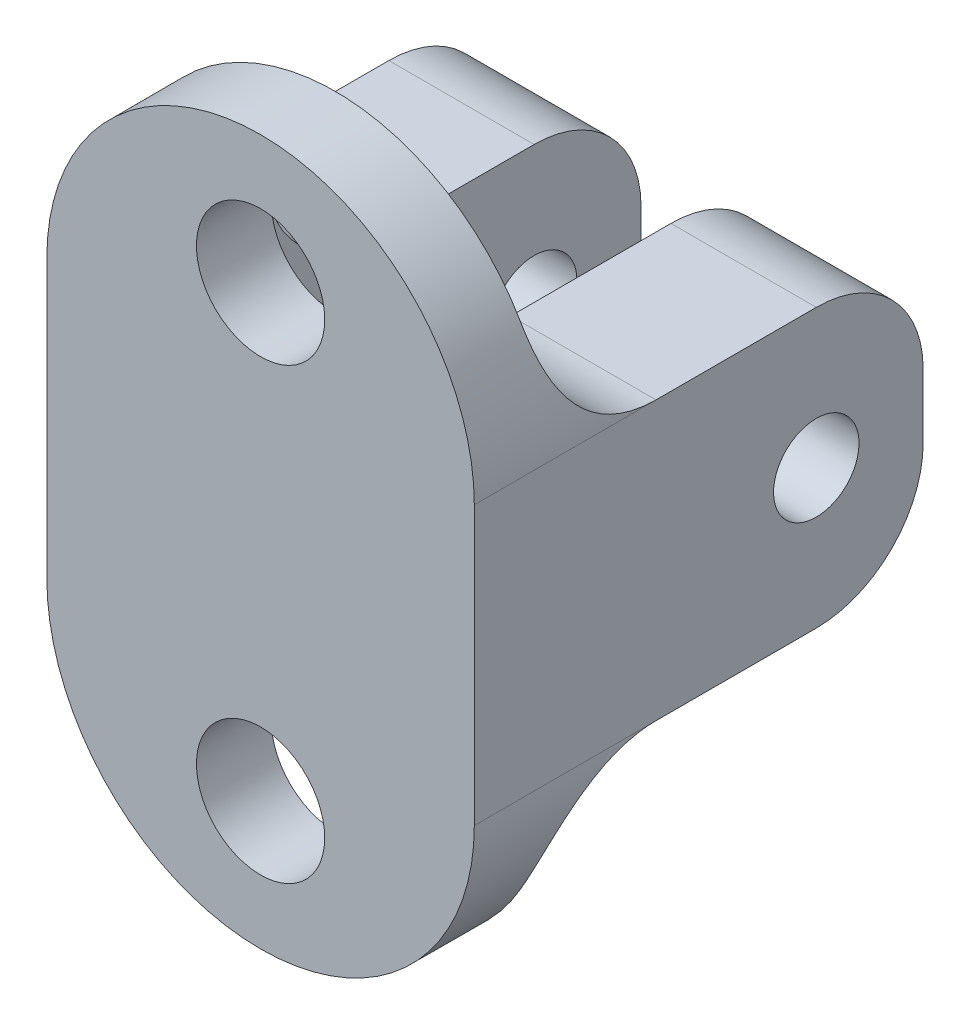
from build123d import *

# Parameters (mm, degrees)
ESQUISSE1_R             = 3
BOSS_EXTRU_1_DEPTH      = 5
ESQUISSE2_R             = 2
BOSS_EXTRU_2_DEPTH      = 20
ESQUISSE3_W             = 6.4
ESQUISSE3_H             = 20
ENL_V_MAT_EXTRU_1_DEPTH = 20
CONG_1_R                = 5
ESQUISSE4_W             = 33.851998375
ESQUISSE4_H             = 43.433745971
ENL_V_MAT_EXTRU_2_DEPTH = 1.5


with BuildPart() as part:
    # Esquisse1 → Boss.-Extru.1 (new body)
    with BuildSketch(Plane.XY):
        with BuildLine():
            Line((-8.244531767, 16.763285024), (-8.244531767, 3.763285024))
            ThreePointArc((-8.244531767, 3.763285024), (1.755468233, -6.236714976), (11.755468233, 3.763285024))
            Line((11.755468233, 3.763285024), (11.755468233, 16.763285024))
            ThreePointArc((11.755468233, 16.763285024), (1.755468233, 26.763285024), (-8.244531767, 16.763285024))
        make_face()
        with Locations((1.755468233, 20.763285024)):
            Circle(ESQUISSE1_R, mode=Mode.SUBTRACT)
        with Locations((1.755468233, -0.236714976)):
            Circle(ESQUISSE1_R, mode=Mode.SUBTRACT)
    extrude(amount=BOSS_EXTRU_1_DEPTH)

    # Esquisse2 → Boss.-Extru.2 (add)
    with BuildSketch(Plane(origin=(11.755468233, 0, 0), x_dir=(0, 0, -1), z_dir=(1, 0, 0))):
        with BuildLine():
            Line((0, 16.763285024), (12.5, 16.763285024))
            ThreePointArc((12.5, 16.763285024), (16.035533906, 15.29881893), (17.5, 11.763285024))
            Line((17.5, 11.763285024), (17.5, 8.763285024))
            ThreePointArc((17.5, 8.763285024), (16.035533906, 5.227751118), (12.5, 3.763285024))
            Line((12.5, 3.763285024), (0, 3.763285024))
            Line((0, 3.763285024), (0, 16.763285024))
        make_face()
        with Locations(Location((12.5, 10.263285024, 0), (0, 0, 90))):
            Circle(ESQUISSE2_R, mode=Mode.SUBTRACT)
    extrude(amount=-BOSS_EXTRU_2_DEPTH)

    # Esquisse3 → Enlèv. mat.-Extru.1 (cut)
    with BuildSketch(Plane(origin=(0, 3.763285024, 0), x_dir=(-1, 0, 0), z_dir=(0, -1, 0))):
        with Locations((-1.755468233, 10)):
            Rectangle(ESQUISSE3_W, ESQUISSE3_H)
    extrude(amount=-ENL_V_MAT_EXTRU_1_DEPTH, mode=Mode.SUBTRACT)

    # Congé1
    # the kernel refuses this fillet: 5 mm, written as the material it adds along each edge
    with BuildSketch(Plane(origin=(11.055468233, 3.763285024, 0), x_dir=(0, -1, 0), z_dir=(-1, 0, 0))) as cong_1_piece_1_section:
        with BuildLine():
            CenterArc((CONG_1_R, -CONG_1_R), CONG_1_R, 90, 90)
            Line((0, -CONG_1_R), (0, 0))
            Line((0, 0), (CONG_1_R, 0))
        make_face()
    cong_1_piece_1 = extrude(amount=31.8, mode=Mode.PRIVATE)
    cong_1_piece_1 = split(cong_1_piece_1, bisect_by=Plane(origin=(4.955468233, 2.647494644, -1.117206211), z_dir=(1, 0, 0)), keep=Keep.TOP, mode=Mode.PRIVATE)
    cong_1_piece_1 = cong_1_piece_1 & Plane(origin=(1.755468233, 3.763285024, -1.117206211), x_dir=(-1, 0, 0), z_dir=(0, 0, -1)) * Cylinder(10, 84, mode=Mode.PRIVATE)
    add(cong_1_piece_1)
    with BuildSketch(Plane(origin=(-1.444531767, 3.763285024, 0), x_dir=(0, -1, 0), z_dir=(-1, 0, 0))) as cong_1_piece_2_section:
        with BuildLine():
            CenterArc((CONG_1_R, -CONG_1_R), CONG_1_R, 90, 90)
            Line((0, -CONG_1_R), (0, 0))
            Line((0, 0), (CONG_1_R, 0))
        make_face()
    cong_1_piece_2 = extrude(amount=19.3, mode=Mode.PRIVATE)
    cong_1_piece_2 = cong_1_piece_2 & Plane(origin=(1.755468233, 3.763285024, -1.127936598), x_dir=(-1, 0, 0), z_dir=(0, 0, -1)) * Cylinder(10, 59, mode=Mode.PRIVATE)
    add(cong_1_piece_2)
    with BuildSketch(Plane(origin=(11.055468233, 16.763285024, 0), x_dir=(0, 1, 0), z_dir=(-1, 0, 0))) as cong_1_piece_3_section:
        with BuildLine():
            CenterArc((CONG_1_R, CONG_1_R), CONG_1_R, 180, 90)
            Line((0, CONG_1_R), (0, 0))
            Line((0, 0), (CONG_1_R, 0))
        make_face()
    cong_1_piece_3 = extrude(amount=31.8, mode=Mode.PRIVATE)
    cong_1_piece_3 = split(cong_1_piece_3, bisect_by=Plane(origin=(4.955468233, 17.879075405, -1.117206211), z_dir=(1, 0, 0)), keep=Keep.TOP, mode=Mode.PRIVATE)
    cong_1_piece_3 = cong_1_piece_3 & Plane(origin=(1.755468233, 16.763285024, -1.117206211), x_dir=(1, 0, 0), z_dir=(0, 0, -1)) * Cylinder(10, 84, mode=Mode.PRIVATE)
    add(cong_1_piece_3)
    with BuildSketch(Plane(origin=(-1.444531767, 16.763285024, 0), x_dir=(0, 1, 0), z_dir=(-1, 0, 0))) as cong_1_piece_4_section:
        with BuildLine():
            CenterArc((CONG_1_R, CONG_1_R), CONG_1_R, 180, 90)
            Line((0, CONG_1_R), (0, 0))
            Line((0, 0), (CONG_1_R, 0))
        make_face()
    cong_1_piece_4 = extrude(amount=19.3, mode=Mode.PRIVATE)
    cong_1_piece_4 = cong_1_piece_4 & Plane(origin=(1.755468233, 16.763285024, -1.127936804), x_dir=(1, 0, 0), z_dir=(0, 0, -1)) * Cylinder(10, 59, mode=Mode.PRIVATE)
    add(cong_1_piece_4)
    with BuildSketch(Plane(origin=(24.255468233, 3.763285024, 0), x_dir=(0, -1, 0), z_dir=(-1, 0, 0))) as cong_1_piece_5_section:
        with BuildLine():
            CenterArc((CONG_1_R, -CONG_1_R), CONG_1_R, 90, 90)
            Line((0, -CONG_1_R), (0, 0))
            Line((0, 0), (CONG_1_R, 0))
        make_face()
    cong_1_piece_5 = extrude(amount=19.3, mode=Mode.PRIVATE)
    cong_1_piece_5 = cong_1_piece_5 & Plane(origin=(1.755468233, 3.763285024, -1.127936804), x_dir=(-1, 0, 0), z_dir=(0, 0, -1)) * Cylinder(10, 59, mode=Mode.PRIVATE)
    add(cong_1_piece_5)
    with BuildSketch(Plane(origin=(24.255468233, 3.763285024, 0), x_dir=(0, -1, 0), z_dir=(-1, 0, 0))) as cong_1_piece_6_section:
        with BuildLine():
            CenterArc((CONG_1_R, -CONG_1_R), CONG_1_R, 90, 90)
            Line((0, -CONG_1_R), (0, 0))
            Line((0, 0), (CONG_1_R, 0))
        make_face()
    cong_1_piece_6 = extrude(amount=31.8, mode=Mode.PRIVATE)
    cong_1_piece_6 = split(cong_1_piece_6, bisect_by=Plane(origin=(-1.444531767, 2.647494643, -1.117206211), z_dir=(-1, 0, 0)), keep=Keep.TOP, mode=Mode.PRIVATE)
    cong_1_piece_6 = cong_1_piece_6 & Plane(origin=(1.755468233, 3.763285024, -1.117206211), x_dir=(-1, 0, 0), z_dir=(0, 0, -1)) * Cylinder(10, 84, mode=Mode.PRIVATE)
    add(cong_1_piece_6)
    with BuildSketch(Plane(origin=(24.255468233, 16.763285024, 0), x_dir=(0, 1, 0), z_dir=(-1, 0, 0))) as cong_1_piece_7_section:
        with BuildLine():
            CenterArc((CONG_1_R, CONG_1_R), CONG_1_R, 180, 90)
            Line((0, CONG_1_R), (0, 0))
            Line((0, 0), (CONG_1_R, 0))
        make_face()
    cong_1_piece_7 = extrude(amount=19.3, mode=Mode.PRIVATE)
    cong_1_piece_7 = cong_1_piece_7 & Plane(origin=(1.755468233, 16.763285024, -1.127936599), x_dir=(1, 0, 0), z_dir=(0, 0, -1)) * Cylinder(10, 59, mode=Mode.PRIVATE)
    add(cong_1_piece_7)
    with BuildSketch(Plane(origin=(24.255468233, 16.763285024, 0), x_dir=(0, 1, 0), z_dir=(-1, 0, 0))) as cong_1_piece_8_section:
        with BuildLine():
            CenterArc((CONG_1_R, CONG_1_R), CONG_1_R, 180, 90)
            Line((0, CONG_1_R), (0, 0))
            Line((0, 0), (CONG_1_R, 0))
        make_face()
    cong_1_piece_8 = extrude(amount=31.8, mode=Mode.PRIVATE)
    cong_1_piece_8 = split(cong_1_piece_8, bisect_by=Plane(origin=(-1.444531767, 17.879075405, -1.117206211), z_dir=(-1, 0, 0)), keep=Keep.TOP, mode=Mode.PRIVATE)
    cong_1_piece_8 = cong_1_piece_8 & Plane(origin=(1.755468233, 16.763285024, -1.117206211), x_dir=(1, 0, 0), z_dir=(0, 0, -1)) * Cylinder(10, 84, mode=Mode.PRIVATE)
    add(cong_1_piece_8)

    # Esquisse4 → Enlèv. mat.-Extru.2 (cut)
    with BuildSketch(Plane.XY.offset(5)):
        with Locations((2.77063873, 9.526227517)):
            Rectangle(ESQUISSE4_W, ESQUISSE4_H)
    extrude(amount=-ENL_V_MAT_EXTRU_2_DEPTH, mode=Mode.SUBTRACT)


solid = part.part
